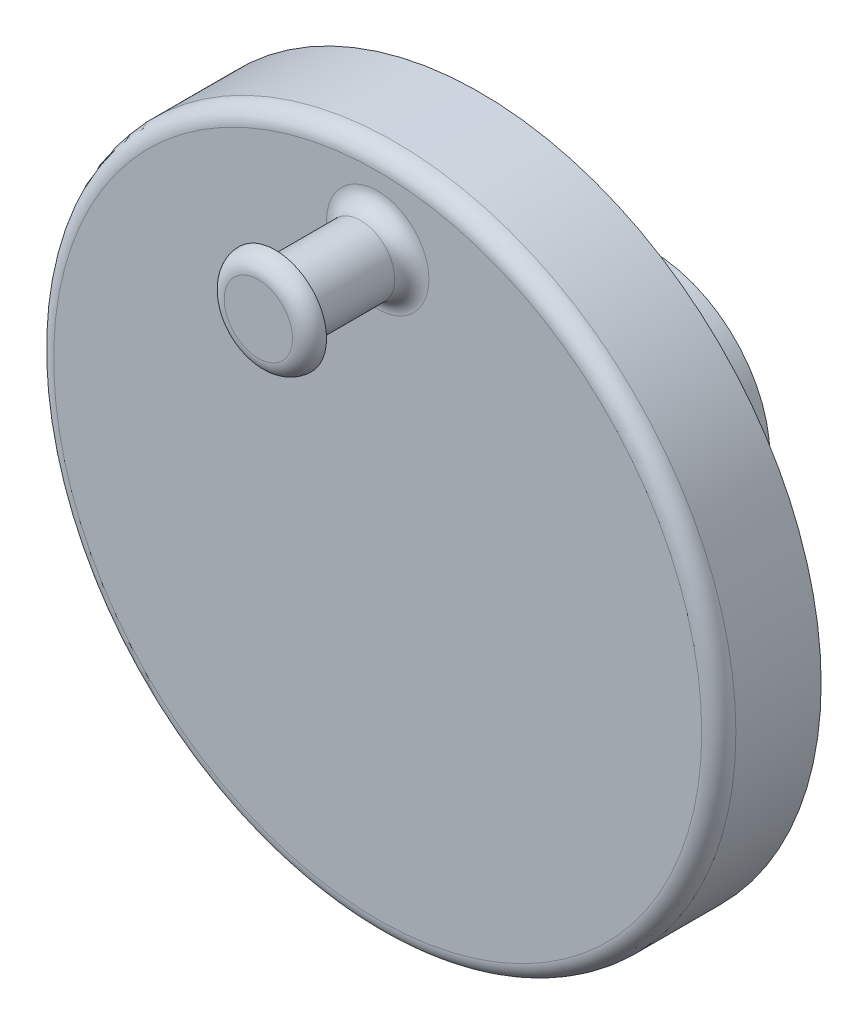
from build123d import *

# Parameters (mm, degrees)
SKETCH1_R           = 20
BOSS_EXTRUDE1_DEPTH = 6
SKETCH2_R           = 7
SKETCH2_R_2         = 3
BOSS_EXTRUDE2_DEPTH = 10
SKETCH3_R           = 2
BOSS_EXTRUDE3_DEPTH = 7
SKETCH4_R           = 3
BOSS_EXTRUDE4_DEPTH = 1
FILLET1_R           = 1


with BuildPart() as part:
    # Sketch1 → Boss-Extrude1 (new body)
    with BuildSketch(Plane.XY):
        Circle(SKETCH1_R)
    extrude(amount=BOSS_EXTRUDE1_DEPTH)

    # Sketch2 → Boss-Extrude2 (add)
    with BuildSketch(Plane(origin=(0, 0, 0), x_dir=(-1, 0, 0), z_dir=(0, 0, -1))):
        with Locations(Location((0, 0, 0), (0, 0, 180))):
            Circle(SKETCH2_R)
        Circle(SKETCH2_R_2, mode=Mode.SUBTRACT)
    extrude(amount=BOSS_EXTRUDE2_DEPTH)

    # Sketch3 → Boss-Extrude3 (add)
    with BuildSketch(Plane.XY.offset(6)):
        with Locations((0, 15)):
            Circle(SKETCH3_R)
    extrude(amount=BOSS_EXTRUDE3_DEPTH)

    # Sketch4 → Boss-Extrude4 (add)
    with BuildSketch(Plane.XY.offset(13)):
        with Locations((0, 15)):
            Circle(SKETCH4_R)
    extrude(amount=-BOSS_EXTRUDE4_DEPTH)

    # Fillet1
    fillet1_edges = [part.edges().sort_by_distance(p)[0] for p in [
        (-2, 15, 6),
        (-3, 15, 13),
        (-20, 0, 6),
        (-7, 0, 0),
    ]]
    fillet(fillet1_edges, radius=FILLET1_R - 0.0001)  # a hair under: the kernel refuses the full size


solid = part.part
